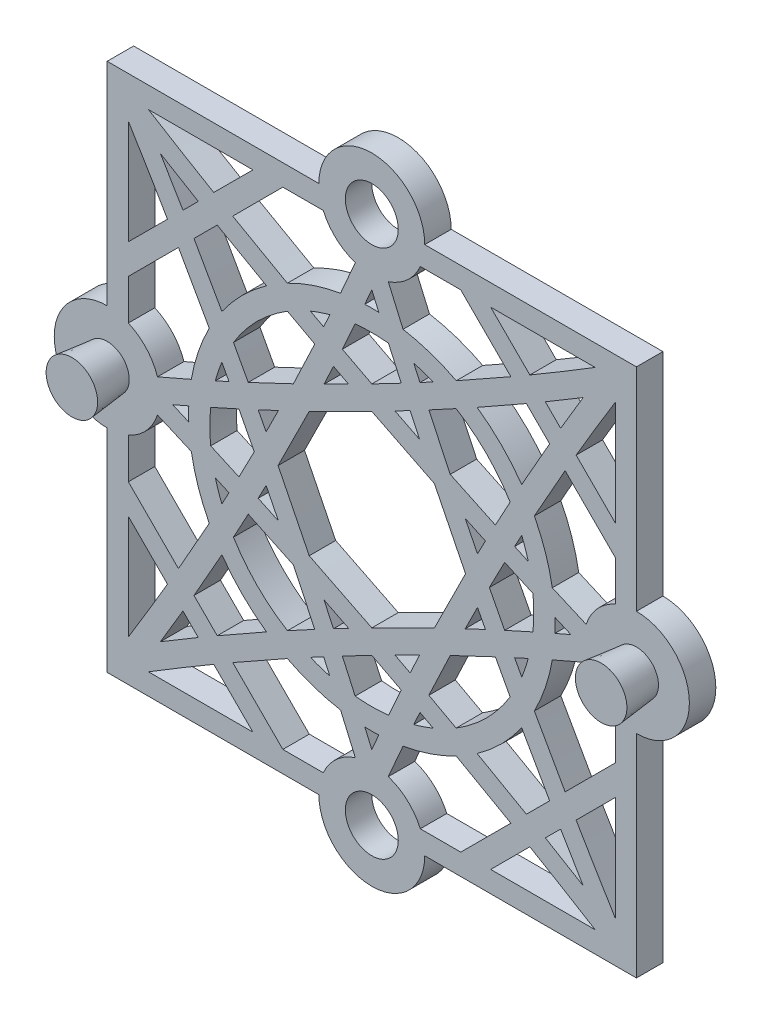
from build123d import *

# Parameters (mm, degrees)
SKETCH1_W                 = 30
SKETCH1_H                 = 30
SKETCH1_W_2               = 27.6
SKETCH1_H_2               = 27.6
EXTRUDE_THIN1_DEPTH       = 1.5
SKETCH2_R                 = 3
BOSS_EXTRUDE1_DEPTH       = 1.5
SKETCH3_R                 = 1.5
CUT_EXTRUDE1_DEPTH        = 26.5
BOSS_EXTRUDE2_OUTLINE_R   = 1.460208471
BOSS_EXTRUDE2_DEPTH       = 2
BOSS_EXTRUDE2_DRAFT       = -6
BOSS_EXTRUDE2_2_OUTLINE_R = 1.460208471
BOSS_EXTRUDE2_2_DEPTH     = 2
BOSS_EXTRUDE2_2_DRAFT     = -6
EXTRUDE_THIN2_DEPTH       = 1.5
SKETCH6_R                 = 10.382811655
SKETCH6_R_2               = 9.182811655
EXTRUDE_THIN3_DEPTH       = 1.5
EXTRUDE_THIN4_DEPTH       = 1.5
CIRPATTERN1_COUNT         = 4
CIRPATTERN1_COPY_1_DEPTH  = 1.5
CIRPATTERN1_COPY_2_DEPTH  = 1.5
CIRPATTERN1_COPY_3_DEPTH  = 1.5


# Read off the part's stored shape, not the designer's step: Boss-Extrude2, Extrude-Thin2
with BuildPart() as part:
    # Sketch1 → Extrude-Thin1 (new body)
    with BuildSketch(Plane.XY):
        Rectangle(SKETCH1_W, SKETCH1_H)
        Rectangle(SKETCH1_W_2, SKETCH1_H_2, mode=Mode.SUBTRACT)
    extrude(amount=EXTRUDE_THIN1_DEPTH)

    # Sketch2 → Boss-Extrude1 (add)
    with BuildSketch(Plane.XY):
        with Locations((0, 15)):
            Circle(SKETCH2_R)
        with Locations((15, 0)):
            Circle(SKETCH2_R)
        with Locations((0, -15)):
            Circle(SKETCH2_R)
        with Locations((-15, 0)):
            Circle(SKETCH2_R)
    extrude(amount=BOSS_EXTRUDE1_DEPTH)

    # Sketch3 → Cut-Extrude1 (cut, through all)
    with BuildSketch(Plane.XY):
        with Locations((0, -15)):
            Circle(SKETCH3_R)
        with Locations((0, 15)):
            Circle(SKETCH3_R)
    extrude(amount=CUT_EXTRUDE1_DEPTH, mode=Mode.SUBTRACT)


with BuildPart() as boss_extrude2_tool:
    # Boss-Extrude2 outline → Boss-Extrude2 (with draft: the straight prism first)
    with BuildSketch(Plane.XY.offset(3.5)):
        with Locations((-15, 0)):
            Circle(BOSS_EXTRUDE2_OUTLINE_R)
    extrude(amount=-BOSS_EXTRUDE2_DEPTH)
    # Boss-Extrude2: the draft: its side faces are tilted about the plane it starts from
    boss_extrude2_sides = [boss_extrude2_tool.faces().sort_by_distance(p)[0] for p in [
        (-16.460208471, 0, 2.5),
    ]]
    draft(boss_extrude2_sides, Plane.XY.offset(3.5), BOSS_EXTRUDE2_DRAFT)


with BuildPart() as part_1:
    add(part.part)

    # Boss-Extrude2: add boss_extrude2_tool
    add(boss_extrude2_tool.part)


with BuildPart() as boss_extrude2_2_tool:
    # Boss-Extrude2 2 outline → Boss-Extrude2 2 (with draft: the straight prism first)
    with BuildSketch(Plane.XY.offset(3.5)):
        with Locations((15, 0)):
            Circle(BOSS_EXTRUDE2_2_OUTLINE_R)
    extrude(amount=-BOSS_EXTRUDE2_2_DEPTH)
    # Boss-Extrude2 2: the draft: its side faces are tilted about the plane it starts from
    boss_extrude2_2_sides = [boss_extrude2_2_tool.faces().sort_by_distance(p)[0] for p in [
        (13.539791529, 0, 2.5),
    ]]
    draft(boss_extrude2_2_sides, Plane.XY.offset(3.5), BOSS_EXTRUDE2_2_DRAFT)


with BuildPart() as part_2:
    add(part_1.part)

    # Boss-Extrude2 2: add boss_extrude2_2_tool
    add(boss_extrude2_2_tool.part)

    # Extrude-Thin2 outline → Extrude-Thin2 (add)
    with BuildSketch(Plane.XY):
        with BuildLine():
            add(Edge.make_bspline(
                [(-13.800000002, -13.093917078), (-5.527932809, -7.973058353), (3.077861348, -3.503585859), (12.016479962, 0.314019394)],
                knots=[0.012356055, 0.012356055, 0.012356055, 0.012356055, 0.97978162, 0.97978162, 0.97978162, 0.97978162], degree=3))
            Line((-13.800000002, -13.093917078), (-13.8, -13.8))
            Line((-13.8, -13.8), (-12.65901004, -13.8))
            add(Edge.make_bspline(
                [(-12.65901004, -13.8), (-4.698880678, -8.906259865), (3.570272911, -4.617909153), (12.149265931, -0.934513385)],
                knots=[0.032319352, 0.032319352, 0.032319352, 0.032319352, 0.967486548, 0.967486548, 0.967486548, 0.967486548], degree=3))
            ThreePointArc((12.149265931, -0.934513385), (12.016824046, -0.317271534), (12.016479962, 0.314019394))
        make_face()
    extrude_thin2 = extrude(amount=EXTRUDE_THIN2_DEPTH)

    # Mirror1: Extrude-Thin2 across plane
    add(extrude_thin2.mirror(Plane.ZX))

    # Sketch6 → Extrude-Thin3 (add)
    with BuildSketch(Plane.XY):
        Circle(SKETCH6_R)
        Circle(SKETCH6_R_2, mode=Mode.SUBTRACT)
    extrude(amount=EXTRUDE_THIN3_DEPTH)

    # Sketch7 → Extrude-Thin4 (add)
    with BuildSketch(Plane.XY):
        Polygon((-5.011526449, -13.830451852), (-13.875596288, -4.966382013), (-14.724124426, -5.81491015), (-5.860054586, -14.67897999), align=None)
    extrude_thin4 = extrude(amount=EXTRUDE_THIN4_DEPTH)

    # CirPattern1: Extrude-Thin2, Extrude-Thin4 ×4 about axis
    cirpattern1_axis = Axis((0, 0, 0), (0, 0, -1))
    add([extrude_thin2.rotate(cirpattern1_axis, i * 360 / CIRPATTERN1_COUNT) for i in range(1, CIRPATTERN1_COUNT)])
    add([extrude_thin4.rotate(cirpattern1_axis, i * 360 / CIRPATTERN1_COUNT) for i in range(1, CIRPATTERN1_COUNT)])

    # CirPattern1 copy 1 sketch → CirPattern1 copy 1 (add)
    with BuildSketch(Plane(origin=(0, 0, 0), x_dir=(0, -1, 0), z_dir=(0, 0, 1))):
        with BuildLine():
            add(Edge.make_bspline(
                [(-13.800000002, 13.093917078), (-5.527932809, 7.973058353), (3.077861348, 3.503585859), (12.016479962, -0.314019394)],
                knots=[0.012356055, 0.012356055, 0.012356055, 0.012356055, 0.97978162, 0.97978162, 0.97978162, 0.97978162], degree=3))
            Line((-13.800000002, 13.093917078), (-13.8, 13.8))
            Line((-13.8, 13.8), (-12.65901004, 13.8))
            add(Edge.make_bspline(
                [(-12.65901004, 13.8), (-4.698880678, 8.906259865), (3.570272911, 4.617909153), (12.149265931, 0.934513385)],
                knots=[0.032319352, 0.032319352, 0.032319352, 0.032319352, 0.967486548, 0.967486548, 0.967486548, 0.967486548], degree=3))
            ThreePointArc((12.149265931, 0.934513385), (12.016824046, 0.317271534), (12.016479962, -0.314019394))
        make_face()
    extrude(amount=CIRPATTERN1_COPY_1_DEPTH)

    # CirPattern1 copy 2 sketch → CirPattern1 copy 2 (add)
    with BuildSketch(Plane(origin=(0, 0, 0), x_dir=(-1, 0, 0), z_dir=(0, 0, 1))):
        with BuildLine():
            add(Edge.make_bspline(
                [(-13.800000002, 13.093917078), (-5.527932809, 7.973058353), (3.077861348, 3.503585859), (12.016479962, -0.314019394)],
                knots=[0.012356055, 0.012356055, 0.012356055, 0.012356055, 0.97978162, 0.97978162, 0.97978162, 0.97978162], degree=3))
            Line((-13.800000002, 13.093917078), (-13.8, 13.8))
            Line((-13.8, 13.8), (-12.65901004, 13.8))
            add(Edge.make_bspline(
                [(-12.65901004, 13.8), (-4.698880678, 8.906259865), (3.570272911, 4.617909153), (12.149265931, 0.934513385)],
                knots=[0.032319352, 0.032319352, 0.032319352, 0.032319352, 0.967486548, 0.967486548, 0.967486548, 0.967486548], degree=3))
            ThreePointArc((12.149265931, 0.934513385), (12.016824046, 0.317271534), (12.016479962, -0.314019394))
        make_face()
    extrude(amount=CIRPATTERN1_COPY_2_DEPTH)

    # CirPattern1 copy 3 sketch → CirPattern1 copy 3 (add)
    with BuildSketch(Plane(origin=(0, 0, 0), x_dir=(0, 1, 0), z_dir=(0, 0, 1))):
        with BuildLine():
            add(Edge.make_bspline(
                [(-13.800000002, 13.093917078), (-5.527932809, 7.973058353), (3.077861348, 3.503585859), (12.016479962, -0.314019394)],
                knots=[0.012356055, 0.012356055, 0.012356055, 0.012356055, 0.97978162, 0.97978162, 0.97978162, 0.97978162], degree=3))
            Line((-13.800000002, 13.093917078), (-13.8, 13.8))
            Line((-13.8, 13.8), (-12.65901004, 13.8))
            add(Edge.make_bspline(
                [(-12.65901004, 13.8), (-4.698880678, 8.906259865), (3.570272911, 4.617909153), (12.149265931, 0.934513385)],
                knots=[0.032319352, 0.032319352, 0.032319352, 0.032319352, 0.967486548, 0.967486548, 0.967486548, 0.967486548], degree=3))
            ThreePointArc((12.149265931, 0.934513385), (12.016824046, 0.317271534), (12.016479962, -0.314019394))
        make_face()
    extrude(amount=CIRPATTERN1_COPY_3_DEPTH)


solid = part_2.part
